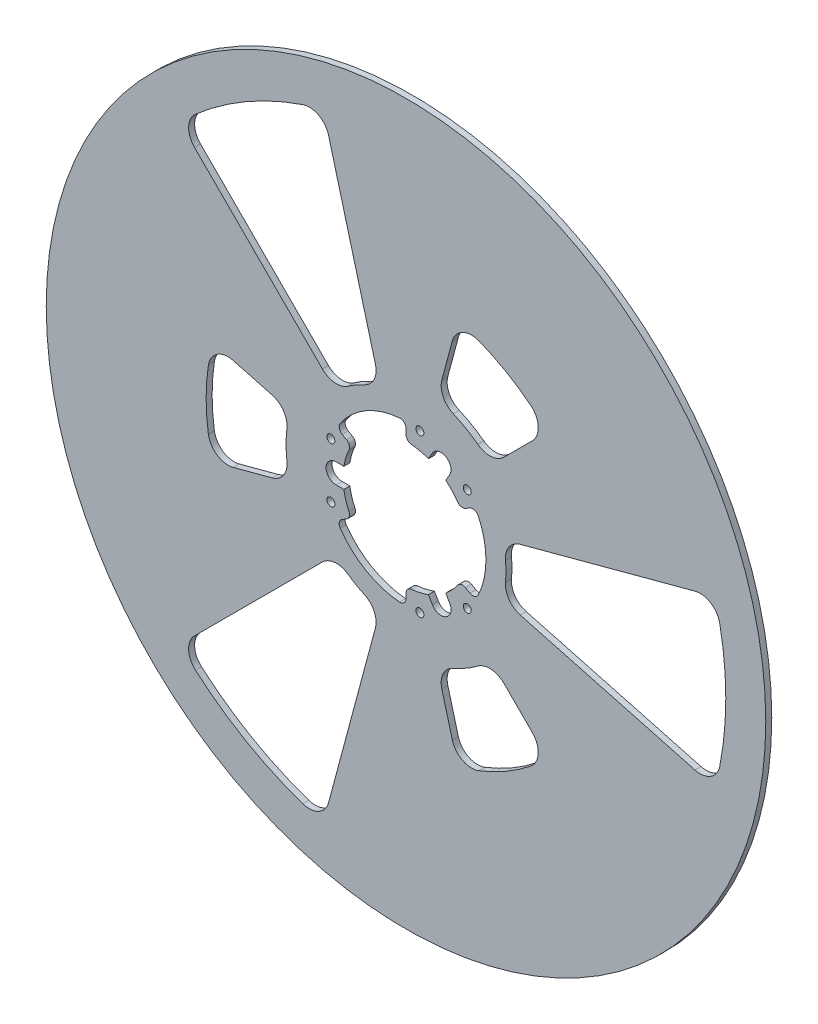
from build123d import *

# Parameters (mm, degrees)
SKETCH1_R           = 180
SKETCH1_R_2         = 2
BOSS_EXTRUDE1_DEPTH = 3


with BuildPart() as part:
    # Sketch1 → Boss-Extrude1 (new body)
    with BuildSketch(Plane.XY):
        Circle(SKETCH1_R)
        with Locations((-37.587704831, 13.680805733)):
            Circle(SKETCH1_R_2, mode=Mode.SUBTRACT)
        with Locations((-37.587704831, -13.680805733)):
            Circle(SKETCH1_R_2, mode=Mode.SUBTRACT)
        with Locations((6.945927107, 39.39231012)):
            Circle(SKETCH1_R_2, mode=Mode.SUBTRACT)
        with Locations((6.945927107, -39.39231012)):
            Circle(SKETCH1_R_2, mode=Mode.SUBTRACT)
        with Locations((30.641777725, -25.711504387)):
            Circle(SKETCH1_R_2, mode=Mode.SUBTRACT)
        with Locations((30.641777725, 25.711504387)):
            Circle(SKETCH1_R_2, mode=Mode.SUBTRACT)
        with BuildLine():
            Line((-35, 5), (-31.10064308, 5))
            ThreePointArc((-31.10064308, 5), (-30.111949846, 9.24772818), (-28.546032489, 13.318184154))
            ThreePointArc((-28.546032489, 13.318184154), (-28.403461209, 15.488413952), (-29.764702249, 17.184658856))
            Line((-29.764702249, 17.184658856), (-31.937438845, 18.439088915))
            ThreePointArc((-31.937438845, 18.439088915), (-33.364334049, 20.378921657), (-32.905339292, 22.742881217))
            ThreePointArc((-32.905339292, 22.742881217), (-20, 34.641016151), (-3.243243243, 39.868300356))
            ThreePointArc((-3.243243243, 39.868300356), (-0.966496832, 39.083821695), (0, 36.878177829))
            Line((0, 36.878177829), (0, 34.369317712))
            ThreePointArc((0, 34.369317712), (0.788370658, 32.342325938), (2.739130435, 31.380681389))
            ThreePointArc((2.739130435, 31.380681389), (7.047207392, 30.701577614), (11.220194521, 29.433946981))
            Line((11.220194521, 29.433946981), (13.169872981, 32.810889132))
            ThreePointArc((13.169872981, 32.810889132), (20, 34.641016151), (21.830127019, 27.810889132))
            Line((21.830127019, 27.810889132), (19.880448559, 24.433946981))
            ThreePointArc((19.880448559, 24.433946981), (23.064742454, 21.453849434), (25.806902054, 18.062497235))
            ThreePointArc((25.806902054, 18.062497235), (27.615090551, 16.853911986), (29.764702249, 17.184658856))
            Line((29.764702249, 17.184658856), (31.937438845, 18.439088915))
            ThreePointArc((31.937438845, 18.439088915), (34.330830881, 18.704900039), (36.148582536, 17.125419139))
            ThreePointArc((36.148582536, 17.125419139), (40, 0), (36.148582536, -17.125419139))
            ThreePointArc((36.148582536, -17.125419139), (34.330830881, -18.704900039), (31.937438845, -18.439088915))
            Line((31.937438845, -18.439088915), (29.764702249, -17.184658856))
            ThreePointArc((29.764702249, -17.184658856), (27.615090551, -16.853911986), (25.806902054, -18.062497235))
            ThreePointArc((25.806902054, -18.062497235), (23.064742454, -21.453849434), (19.880448559, -24.433946981))
            Line((19.880448559, -24.433946981), (21.830127019, -27.810889132))
            ThreePointArc((21.830127019, -27.810889132), (20, -34.641016151), (13.169872981, -32.810889132))
            Line((13.169872981, -32.810889132), (11.220194521, -29.433946981))
            ThreePointArc((11.220194521, -29.433946981), (7.047207392, -30.701577614), (2.739130435, -31.380681389))
            ThreePointArc((2.739130435, -31.380681389), (0.788370658, -32.342325938), (0, -34.369317712))
            Line((0, -34.369317712), (0, -36.878177829))
            ThreePointArc((0, -36.878177829), (-0.966496832, -39.083821695), (-3.243243243, -39.868300356))
            ThreePointArc((-3.243243243, -39.868300356), (-20, -34.641016151), (-32.905339292, -22.742881217))
            ThreePointArc((-32.905339292, -22.742881217), (-33.364334049, -20.378921657), (-31.937438845, -18.439088915))
            Line((-31.937438845, -18.439088915), (-29.764702249, -17.184658856))
            ThreePointArc((-29.764702249, -17.184658856), (-28.403461209, -15.488413952), (-28.546032489, -13.318184154))
            ThreePointArc((-28.546032489, -13.318184154), (-30.111949846, -9.24772818), (-31.10064308, -5))
            Line((-31.10064308, -5), (-35, -5))
            ThreePointArc((-35, -5), (-40, 0), (-35, 5))
        make_face(mode=Mode.SUBTRACT)
        with BuildLine():
            Line((-66.921304299, -17.931509443), (-86.395032352, -23.149479149))
            ThreePointArc((-86.395032352, -23.149479149), (-94.457348532, -21.858849657), (-98.870247559, -14.989134318))
            ThreePointArc((-98.870247559, -14.989134318), (-100, 0), (-98.870247559, 14.989134318))
            ThreePointArc((-98.870247559, 14.989134318), (-94.457348532, 21.858849657), (-86.395032352, 23.149479149))
            Line((-86.395032352, 23.149479149), (-66.921304299, 17.931509443))
            ThreePointArc((-66.921304299, 17.931509443), (-61.229537792, 13.879595719), (-59.579566929, 7.090501012))
            ThreePointArc((-59.579566929, 7.090501012), (-60, 0), (-59.579566929, -7.090501012))
            ThreePointArc((-59.579566929, -7.090501012), (-61.229537792, -13.879595719), (-66.921304299, -17.931509443))
        make_face(mode=Mode.SUBTRACT)
        with BuildLine():
            Line((17.931509443, 66.921304299), (23.149479149, 86.395032352))
            ThreePointArc((23.149479149, 86.395032352), (28.298355166, 92.731888231), (36.45415268, 93.118713224))
            ThreePointArc((36.45415268, 93.118713224), (50, 86.602540378), (62.416094879, 78.129578906))
            ThreePointArc((62.416094879, 78.129578906), (66.158993366, 70.873038574), (63.245553203, 63.245553203))
            Line((63.245553203, 63.245553203), (48.989794856, 48.989794856))
            ThreePointArc((48.989794856, 48.989794856), (42.634851383, 46.08653733), (35.930337466, 48.052168001))
            ThreePointArc((35.930337466, 48.052168001), (30, 51.961524227), (23.649229463, 55.142669013))
            ThreePointArc((23.649229463, 55.142669013), (18.594686409, 59.96613305), (17.931509443, 66.921304299))
        make_face(mode=Mode.SUBTRACT)
        with BuildLine():
            Line((48.989794856, -48.989794856), (63.245553203, -63.245553203))
            ThreePointArc((63.245553203, -63.245553203), (66.158993366, -70.873038574), (62.416094879, -78.129578906))
            ThreePointArc((62.416094879, -78.129578906), (50, -86.602540378), (36.45415268, -93.118713224))
            ThreePointArc((36.45415268, -93.118713224), (28.298355166, -92.731888231), (23.149479149, -86.395032352))
            Line((23.149479149, -86.395032352), (17.931509443, -66.921304299))
            ThreePointArc((17.931509443, -66.921304299), (18.594686409, -59.96613305), (23.649229463, -55.142669013))
            ThreePointArc((23.649229463, -55.142669013), (30, -51.961524227), (35.930337466, -48.052168001))
            ThreePointArc((35.930337466, -48.052168001), (42.634851383, -46.08653733), (48.989794856, -48.989794856))
        make_face(mode=Mode.SUBTRACT)
        with BuildLine():
            Line((57.144942529, -15.311941202), (144.56654012, -38.736487678))
            ThreePointArc((144.56654012, -38.736487678), (152.440784749, -37.565906063), (156.965045943, -31.015711376))
            ThreePointArc((156.965045943, -31.015711376), (160, 0), (156.965045943, 31.015711376))
            ThreePointArc((156.965045943, 31.015711376), (152.440784749, 37.565906063), (144.56654012, 38.736487678))
            Line((144.56654012, 38.736487678), (57.144942529, 15.311941202))
            ThreePointArc((57.144942529, 15.311941202), (51.521345473, 11.359393545), (49.777610817, 4.710569116))
            ThreePointArc((49.777610817, 4.710569116), (50, 0), (49.777610817, -4.710569116))
            ThreePointArc((49.777610817, -4.710569116), (51.521345473, -11.359393545), (57.144942529, -15.311941202))
        make_face(mode=Mode.SUBTRACT)
        with BuildLine():
            Line((-41.833001327, 41.833001327), (-105.830052443, 105.830052443))
            ThreePointArc((-105.830052443, 105.830052443), (-108.753421341, 113.234639134), (-105.342916939, 120.427861605))
            ThreePointArc((-105.342916939, 120.427861605), (-80, 138.564064606), (-51.622129003, 151.443572981))
            ThreePointArc((-51.622129003, 151.443572981), (-43.687363408, 150.800545197), (-38.736487678, 144.56654012))
            Line((-38.736487678, 144.56654012), (-15.311941202, 57.144942529))
            ThreePointArc((-15.311941202, 57.144942529), (-15.923149355, 50.298490789), (-20.809332888, 45.463960065))
            ThreePointArc((-20.809332888, 45.463960065), (-25, 43.301270189), (-28.968277929, 40.753390949))
            ThreePointArc((-28.968277929, 40.753390949), (-35.598196118, 38.939097244), (-41.833001327, 41.833001327))
        make_face(mode=Mode.SUBTRACT)
        with BuildLine():
            Line((-15.311941202, -57.144942529), (-38.736487678, -144.56654012))
            ThreePointArc((-38.736487678, -144.56654012), (-43.687363408, -150.800545197), (-51.622129003, -151.443572981))
            ThreePointArc((-51.622129003, -151.443572981), (-80, -138.564064606), (-105.342916939, -120.427861605))
            ThreePointArc((-105.342916939, -120.427861605), (-108.753421341, -113.234639134), (-105.830052443, -105.830052443))
            Line((-105.830052443, -105.830052443), (-41.833001327, -41.833001327))
            ThreePointArc((-41.833001327, -41.833001327), (-35.598196118, -38.939097244), (-28.968277929, -40.753390949))
            ThreePointArc((-28.968277929, -40.753390949), (-25, -43.301270189), (-20.809332888, -45.463960065))
            ThreePointArc((-20.809332888, -45.463960065), (-15.923149355, -50.298490789), (-15.311941202, -57.144942529))
        make_face(mode=Mode.SUBTRACT)
    extrude(amount=BOSS_EXTRUDE1_DEPTH)


solid = part.part
